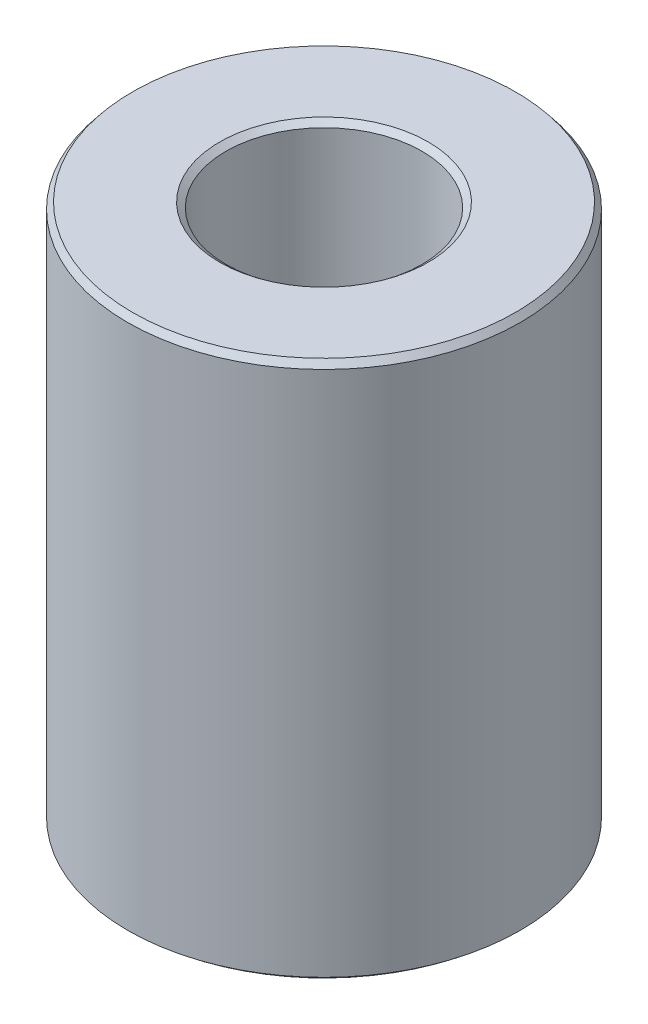
from build123d import *
from OCP.BRepFilletAPI import BRepFilletAPI_MakeChamfer

# Parameters (mm, degrees)
SKETCH1_R           = 35
BOSS_EXTRUDE1_DEPTH = 95.886832146
SKETCH2_R           = 17.492548208
CUT_EXTRUDE1_DEPTH  = 108.9086863
CHAMFER1_SIZE       = 1.107082813
CHAMFER1_SIZE2      = 0.882135957


with BuildPart() as part:
    # Sketch1 → Boss-Extrude1 (new body)
    with BuildSketch(Plane(origin=(0, 0, 0), x_dir=(1, 0, 0), z_dir=(0, 1, 0))):
        Circle(SKETCH1_R)
    extrude(amount=BOSS_EXTRUDE1_DEPTH)

    # Sketch2 → Cut-Extrude1 (cut, through all)
    with BuildSketch(Plane(origin=(0, 0, 0), x_dir=(1, 0, 0), z_dir=(0, 1, 0))):
        Circle(SKETCH2_R)
    extrude(amount=CUT_EXTRUDE1_DEPTH, mode=Mode.SUBTRACT)

    # Chamfer1: one chamfer whose edges measure the first distance from different faces: ONE call of the kernel's chamfer builder (chamfer() names one face for all edges)
    chamfer1_edges_1 = [part.edges().sort_by_distance(p)[0] for p in [
        (-17.492548208, 95.886832146, 0),
    ]]
    chamfer1_side_1 = [part.faces().sort_by_distance(p)[0] for p in [
        (-34.010050506, 95.886832146, 0),
    ]]
    chamfer1_edges_2 = [part.edges().sort_by_distance(p)[0] for p in [
        (-17.492548208, 0, 0),
    ]]
    chamfer1_side_2 = [part.faces().sort_by_distance(p)[0] for p in [
        (-17.492548208, 47.943416073, 0),
    ]]
    chamfer1_edges_3 = [part.edges().sort_by_distance(p)[0] for p in [
        (-35, 0, 0),
    ]]
    chamfer1_side_3 = [part.faces().sort_by_distance(p)[0] for p in [
        (-34.010050506, 0, 0),
    ]]
    chamfer1_edges_4 = [part.edges().sort_by_distance(p)[0] for p in [
        (-35, 95.886832146, 0),
    ]]
    chamfer1_side_4 = [part.faces().sort_by_distance(p)[0] for p in [
        (-35, 47.943416073, 0),
    ]]
    chamfer1 = BRepFilletAPI_MakeChamfer(part.part.solid().wrapped)
    for e in chamfer1_edges_1:
        chamfer1.Add(CHAMFER1_SIZE, CHAMFER1_SIZE2, e.wrapped, chamfer1_side_1[0].wrapped)  # the first distance lies on this face
    for e in chamfer1_edges_2:
        chamfer1.Add(CHAMFER1_SIZE, CHAMFER1_SIZE2, e.wrapped, chamfer1_side_2[0].wrapped)  # the first distance lies on this face
    for e in chamfer1_edges_3:
        chamfer1.Add(CHAMFER1_SIZE, CHAMFER1_SIZE2, e.wrapped, chamfer1_side_3[0].wrapped)  # the first distance lies on this face
    for e in chamfer1_edges_4:
        chamfer1.Add(CHAMFER1_SIZE, CHAMFER1_SIZE2, e.wrapped, chamfer1_side_4[0].wrapped)  # the first distance lies on this face
    add(Compound.cast(chamfer1.Shape()), mode=Mode.REPLACE)


solid = part.part
